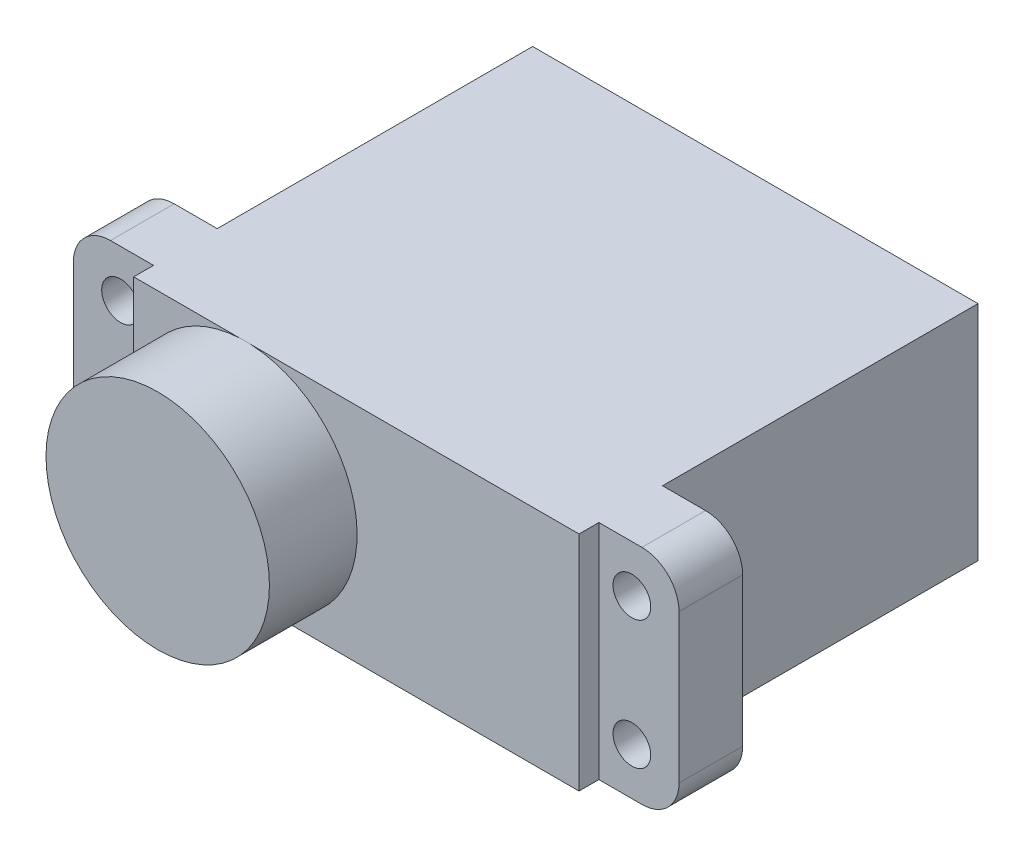
from build123d import *

# Parameters (mm, degrees)
SKETCH1_W            = 24
SKETCH1_H            = 12
EXTRUDE1_DEPTH       = 21.5
SKETCH2_W            = 3.43
SKETCH2_H            = 12
EXTRUDE2_DEPTH       = 4.318
FILLET1_R            = 2
FILLET2_R            = 2
SKETCH3_R            = 1.016
CUT_EXTRUDE1_DEPTH   = 4.318
FILLET1_OF_MIRROR1_R = 2
FILLET2_OF_MIRROR1_R = 2
SKETCH4_R            = 6.02
EXTRUDE3_DEPTH       = 4.725


with BuildPart() as part:
    # Sketch1 → Extrude1 (new body)
    with BuildSketch(Plane.XY):
        with Locations((-12, 6)):
            Rectangle(SKETCH1_W, SKETCH1_H)
    extrude(amount=EXTRUDE1_DEPTH)

    # Sketch2 → Extrude2 (add)
    with BuildSketch(Plane.ZY.offset(24)):
        with Locations((18.715, 6)):
            Rectangle(SKETCH2_W, SKETCH2_H)
    extrude2 = extrude(amount=EXTRUDE2_DEPTH)

    # Fillet1
    fillet1_edges = [part.edges().sort_by_distance(p)[0] for p in [
        (-28.318, 12, 18.715),
    ]]
    fillet(fillet1_edges, radius=FILLET1_R)

    # Fillet2
    fillet2_edges = [part.edges().sort_by_distance(p)[0] for p in [
        (-28.318, 0, 18.715),
    ]]
    fillet(fillet2_edges, radius=FILLET2_R)

    # Sketch3 → Cut-Extrude1 (cut)
    with BuildSketch(Plane.XY.offset(20.43)):
        with Locations((-25.778, 2.53620247)):
            Circle(SKETCH3_R)
        with Locations((-25.778, 9.46)):
            Circle(SKETCH3_R)
    cut_extrude1 = extrude(amount=-CUT_EXTRUDE1_DEPTH, mode=Mode.SUBTRACT)

    # Mirror1: Extrude2, Cut-Extrude1 across plane
    add(extrude2.mirror(Plane.ZY.offset(12)))
    add(cut_extrude1.mirror(Plane.ZY.offset(12)), mode=Mode.SUBTRACT)

    # Fillet1 of Mirror1
    fillet1_of_mirror1_edges = [part.edges().sort_by_distance(p)[0] for p in [
        (4.318, 12, 18.715),
    ]]
    fillet(fillet1_of_mirror1_edges, radius=FILLET1_OF_MIRROR1_R)

    # Fillet2 of Mirror1
    fillet2_of_mirror1_edges = [part.edges().sort_by_distance(p)[0] for p in [
        (4.318, 0, 18.715),
    ]]
    fillet(fillet2_of_mirror1_edges, radius=FILLET2_OF_MIRROR1_R)

    # Sketch4 → Extrude3 (add)
    with BuildSketch(Plane.XY.offset(21.5)):
        with Locations((-17.98, 5.987133141)):
            Circle(SKETCH4_R)
    extrude(amount=EXTRUDE3_DEPTH)


solid = part.part
